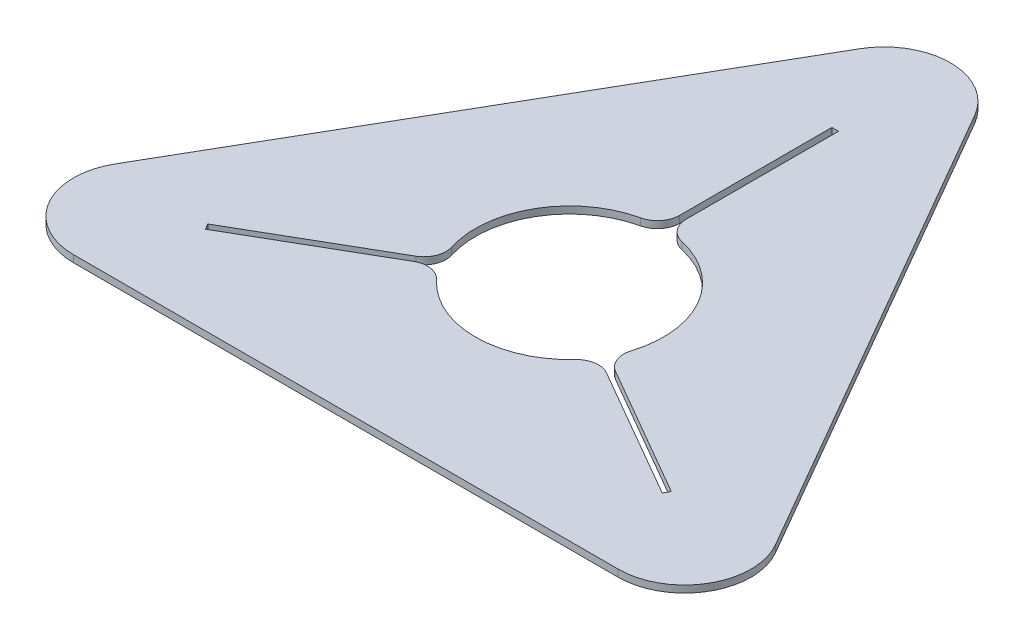
from build123d import *

# Parameters (mm, degrees)
BOSS_EXTRUDE1_DEPTH = 6.35
SKETCH2_R           = 85
CUT_EXTRUDE1_DEPTH  = 6.35
FILLET1_R           = 60
SKETCH3_W           = 6
SKETCH3_H           = 210
CUT_EXTRUDE2_DEPTH  = 6.35
FILLET2_R           = 20


with BuildPart() as part:
    # Sketch1 → Boss-Extrude1 (new body)
    with BuildSketch(Plane(origin=(0, 0, 0), x_dir=(1, 0, 0), z_dir=(0, 1, 0))):
        Polygon((0, 0), (-350, -606.217782649), (350, -606.217782649), align=None)
    extrude(amount=BOSS_EXTRUDE1_DEPTH)

    # Sketch2 → Cut-Extrude1 (cut)
    with BuildSketch(Plane(origin=(0, 6.35, 0), x_dir=(1, 0, 0), z_dir=(0, 1, 0))):
        with Locations((0, -404.145188433)):
            Circle(SKETCH2_R)
    extrude(amount=-CUT_EXTRUDE1_DEPTH, mode=Mode.SUBTRACT)

    # Fillet1
    fillet1_edges = [part.edges().sort_by_distance(p)[0] for p in [
        (0, 3.175, 0),
        (350, 3.175, 606.217782649),
        (-350, 3.175, 606.217782649),
    ]]
    fillet(fillet1_edges, radius=FILLET1_R)

    # Sketch3 → Cut-Extrude2 (cut)
    with BuildSketch(Plane(origin=(0, 6.35, 0), x_dir=(1, 0, 0), z_dir=(0, 1, 0))):
        Polygon((27.480762114, -416.547112221), (24.480762114, -421.743264644), (206.346096908, -526.743264644), (209.346096908, -521.547112221), align=None)
        with Locations((0, -269.145188433)):
            Rectangle(SKETCH3_W, SKETCH3_H)
        Polygon((-24.480762114, -421.743264644), (-27.480762114, -416.547112221), (-209.346096908, -521.547112221), (-206.346096908, -526.743264644), align=None)
    extrude(amount=-CUT_EXTRUDE2_DEPTH, mode=Mode.SUBTRACT)

    # Fillet2
    fillet2_edges = [part.edges().sort_by_distance(p)[0] for p in [
        (-3, 3.175, 319.198146106),
        (3, 3.175, 319.198146106),
        (75.066296631, 3.175, 444.020633385),
        (72.066296631, 3.175, 449.216785807),
        (-72.066296631, 3.175, 449.216785807),
        (-75.066296631, 3.175, 444.020633385),
    ]]
    fillet(fillet2_edges, radius=FILLET2_R)


solid = part.part
